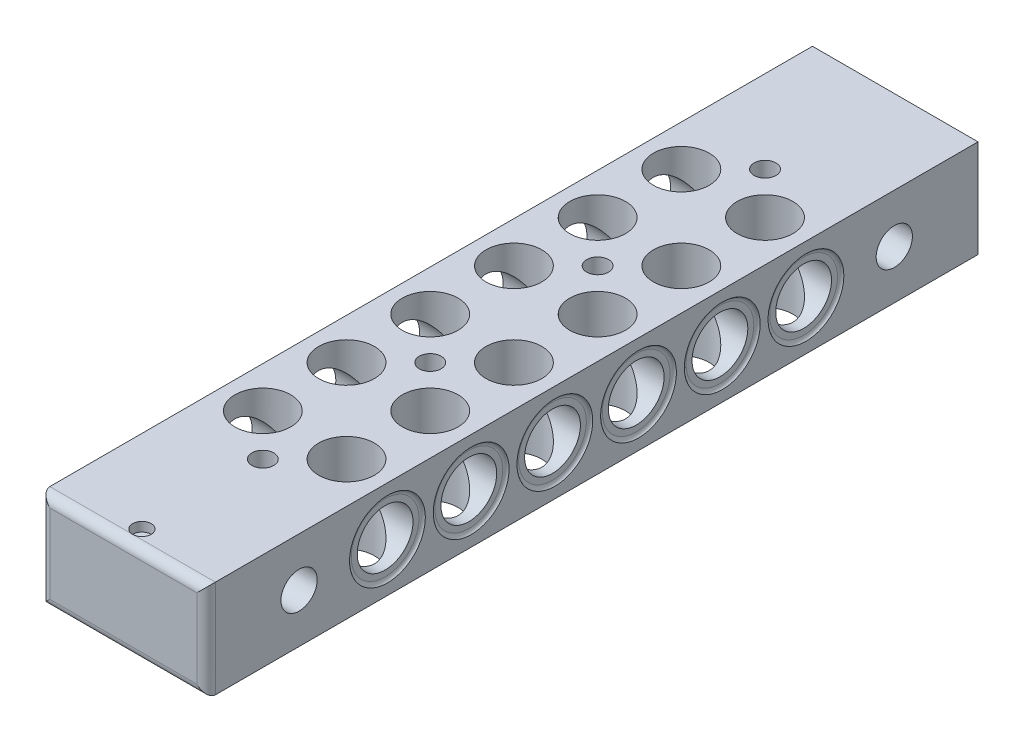
from build123d import *

# Parameters (mm, degrees)
SKETCH1_W            = 17.8
SKETCH1_H            = 83
SKETCH1_R            = 1.175
SKETCH1_R_2          = 3
BOSS_EXTRUDE1_DEPTH  = 10.5
SKETCH3_R            = 1
CUT_EXTRUDE1_DEPTH   = 1
FILLET1_R            = 1
CUT_EXTRUDE2_REACH   = 48.809
SKETCH4_R            = 1.95
CUT_EXTRUDE4_REACH   = 48.809
SKETCH4_3_R          = 3
SKETCH4_4_R          = 4.075
SKETCH4_4_R_2        = 3
CUT_EXTRUDE5_DEPTH   = 0.25
FILLET8_R            = 0.5
FILLET8_OF_MIRROR3_R = 0.5


# Some blends are built 0.0001 mm under size
with BuildPart() as part:
    # Sketch1 → Boss-Extrude1 (new body)
    with BuildSketch(Plane(origin=(0, 0, 0), x_dir=(1, 0, 0), z_dir=(0, 1, 0))):
        with Locations((0, -0.5)):
            Rectangle(SKETCH1_W, SKETCH1_H)
        with Locations(Location((0, 27, 0), (0, 0, 90))):
            Circle(SKETCH1_R, mode=Mode.SUBTRACT)
        with Locations(Location((0, 9, 0), (0, 0, 90))):
            Circle(SKETCH1_R, mode=Mode.SUBTRACT)
        with Locations(Location((0, -9, 0), (0, 0, 90))):
            Circle(SKETCH1_R, mode=Mode.SUBTRACT)
        with Locations(Location((0, -27, 0), (0, 0, 90))):
            Circle(SKETCH1_R, mode=Mode.SUBTRACT)
        with Locations(Location((-4.5, -22.5, 0), (0, 0, 90))):
            Circle(SKETCH1_R_2, mode=Mode.SUBTRACT)
        with Locations(Location((-4.5, -13.5, 0), (0, 0, 90))):
            Circle(SKETCH1_R_2, mode=Mode.SUBTRACT)
        with Locations(Location((-4.5, -4.5, 0), (0, 0, 90))):
            Circle(SKETCH1_R_2, mode=Mode.SUBTRACT)
        with Locations(Location((-4.5, 4.5, 0), (0, 0, 90))):
            Circle(SKETCH1_R_2, mode=Mode.SUBTRACT)
        with Locations(Location((-4.5, 13.5, 0), (0, 0, 90))):
            Circle(SKETCH1_R_2, mode=Mode.SUBTRACT)
        with Locations(Location((-4.5, 22.5, 0), (0, 0, 90))):
            Circle(SKETCH1_R_2, mode=Mode.SUBTRACT)
        with Locations(Location((4.5, -13.5, 0), (0, 0, 90))):
            Circle(SKETCH1_R_2, mode=Mode.SUBTRACT)
        with Locations(Location((4.5, -4.5, 0), (0, 0, 90))):
            Circle(SKETCH1_R_2, mode=Mode.SUBTRACT)
        with Locations(Location((4.5, 4.5, 0), (0, 0, 90))):
            Circle(SKETCH1_R_2, mode=Mode.SUBTRACT)
        with Locations(Location((4.5, 13.5, 0), (0, 0, 90))):
            Circle(SKETCH1_R_2, mode=Mode.SUBTRACT)
        with Locations(Location((4.5, 22.5, 0), (0, 0, 90))):
            Circle(SKETCH1_R_2, mode=Mode.SUBTRACT)
        with Locations(Location((4.5, -22.5, 0), (0, 0, 90))):
            Circle(SKETCH1_R_2, mode=Mode.SUBTRACT)
    extrude(amount=BOSS_EXTRUDE1_DEPTH)

    # Sketch3 → Cut-Extrude1 (cut)
    with BuildSketch(Plane(origin=(0, 10.5, 0), x_dir=(1, 0, 0), z_dir=(0, 1, 0))):
        with Locations(Location((0, -40, 0), (0, 0, 270))):
            Circle(SKETCH3_R)
    extrude(amount=-CUT_EXTRUDE1_DEPTH, mode=Mode.SUBTRACT)

    # Fillet1
    fillet1_edges = [part.edges().sort_by_distance(p)[0] for p in [
        (0, 10.5, 42),
        (0, 0, 42),
        (-8.9, 5.25, 42),
        (8.9, 5.25, 42),
    ]]
    fillet(fillet1_edges, radius=FILLET1_R - 0.0001)  # a hair under: the kernel refuses the full size

    # Sketch4 → Cut-Extrude2 (cut, up to next)
    with BuildSketch(Plane(origin=(8.9, 0, 0), x_dir=(0, 0, -1), z_dir=(1, 0, 0)), mode=Mode.PRIVATE) as cut_extrude2_sk1:
        with Locations((-32, 5.25)):
            Circle(SKETCH4_R)
    cut_extrude2_tool1 = extrude(cut_extrude2_sk1.sketch, amount=-CUT_EXTRUDE2_REACH, mode=Mode.PRIVATE) & part.part
    # Sketch4 → Cut-Extrude2 (cut, up to next)
    with BuildSketch(Plane(origin=(8.9, 0, 0), x_dir=(0, 0, -1), z_dir=(1, 0, 0)), mode=Mode.PRIVATE) as cut_extrude2_sk2:
        with Locations((32, 5.25)):
            Circle(SKETCH4_R)
    cut_extrude2_tool2 = extrude(cut_extrude2_sk2.sketch, amount=-CUT_EXTRUDE2_REACH, mode=Mode.PRIVATE) & part.part
    add(cut_extrude2_tool1.solids().sort_by_distance((8.9, 5.25, 32))[0], mode=Mode.SUBTRACT)
    add(cut_extrude2_tool2.solids().sort_by_distance((8.9, 5.25, -32))[0], mode=Mode.SUBTRACT)

    # Sketch4<3> → Cut-Extrude4 (cut, up to next)
    with BuildSketch(Plane(origin=(8.9, 0, 0), x_dir=(0, 0, -1), z_dir=(1, 0, 0)), mode=Mode.PRIVATE) as cut_extrude4_sk1:
        with Locations((-22.5, 5.25)):
            Circle(SKETCH4_3_R)
    cut_extrude4_tool1 = extrude(cut_extrude4_sk1.sketch, amount=-CUT_EXTRUDE4_REACH, mode=Mode.PRIVATE) & part.part
    # Sketch4<3> → Cut-Extrude4 (cut, up to next)
    with BuildSketch(Plane(origin=(8.9, 0, 0), x_dir=(0, 0, -1), z_dir=(1, 0, 0)), mode=Mode.PRIVATE) as cut_extrude4_sk2:
        with Locations((-13.5, 5.25)):
            Circle(SKETCH4_3_R)
    cut_extrude4_tool2 = extrude(cut_extrude4_sk2.sketch, amount=-CUT_EXTRUDE4_REACH, mode=Mode.PRIVATE) & part.part
    # Sketch4<3> → Cut-Extrude4 (cut, up to next)
    with BuildSketch(Plane(origin=(8.9, 0, 0), x_dir=(0, 0, -1), z_dir=(1, 0, 0)), mode=Mode.PRIVATE) as cut_extrude4_sk3:
        with Locations((-4.5, 5.25)):
            Circle(SKETCH4_3_R)
    cut_extrude4_tool3 = extrude(cut_extrude4_sk3.sketch, amount=-CUT_EXTRUDE4_REACH, mode=Mode.PRIVATE) & part.part
    # Sketch4<3> → Cut-Extrude4 (cut, up to next)
    with BuildSketch(Plane(origin=(8.9, 0, 0), x_dir=(0, 0, -1), z_dir=(1, 0, 0)), mode=Mode.PRIVATE) as cut_extrude4_sk4:
        with Locations((4.5, 5.25)):
            Circle(SKETCH4_3_R)
    cut_extrude4_tool4 = extrude(cut_extrude4_sk4.sketch, amount=-CUT_EXTRUDE4_REACH, mode=Mode.PRIVATE) & part.part
    # Sketch4<3> → Cut-Extrude4 (cut, up to next)
    with BuildSketch(Plane(origin=(8.9, 0, 0), x_dir=(0, 0, -1), z_dir=(1, 0, 0)), mode=Mode.PRIVATE) as cut_extrude4_sk5:
        with Locations((13.5, 5.25)):
            Circle(SKETCH4_3_R)
    cut_extrude4_tool5 = extrude(cut_extrude4_sk5.sketch, amount=-CUT_EXTRUDE4_REACH, mode=Mode.PRIVATE) & part.part
    # Sketch4<3> → Cut-Extrude4 (cut, up to next)
    with BuildSketch(Plane(origin=(8.9, 0, 0), x_dir=(0, 0, -1), z_dir=(1, 0, 0)), mode=Mode.PRIVATE) as cut_extrude4_sk6:
        with Locations((22.5, 5.25)):
            Circle(SKETCH4_3_R)
    cut_extrude4_tool6 = extrude(cut_extrude4_sk6.sketch, amount=-CUT_EXTRUDE4_REACH, mode=Mode.PRIVATE) & part.part
    cut_extrude4_1 = cut_extrude4_tool1.solids().sort_by_distance((8.9, 5.25, 22.5))[0]
    add(cut_extrude4_1, mode=Mode.SUBTRACT)
    cut_extrude4_2 = cut_extrude4_tool2.solids().sort_by_distance((8.9, 5.25, 13.5))[0]
    add(cut_extrude4_2, mode=Mode.SUBTRACT)
    cut_extrude4_3 = cut_extrude4_tool3.solids().sort_by_distance((8.9, 5.25, 4.5))[0]
    add(cut_extrude4_3, mode=Mode.SUBTRACT)
    cut_extrude4_4 = cut_extrude4_tool4.solids().sort_by_distance((8.9, 5.25, -4.5))[0]
    add(cut_extrude4_4, mode=Mode.SUBTRACT)
    cut_extrude4_5 = cut_extrude4_tool5.solids().sort_by_distance((8.9, 5.25, -13.5))[0]
    add(cut_extrude4_5, mode=Mode.SUBTRACT)
    cut_extrude4_6 = cut_extrude4_tool6.solids().sort_by_distance((8.9, 5.25, -22.5))[0]
    add(cut_extrude4_6, mode=Mode.SUBTRACT)
    cut_extrude4 = cut_extrude4_1 + cut_extrude4_2 + cut_extrude4_3 + cut_extrude4_4 + cut_extrude4_5 + cut_extrude4_6  # Cut-Extrude4 as one shape, for the pattern or mirror that repeats it

    # Sketch4<4> → Cut-Extrude5 (cut)
    # profile 1 of 6: a face of its own
    with BuildSketch(Plane(origin=(8.9, 0, 0), x_dir=(0, 0, -1), z_dir=(1, 0, 0))):
        with Locations((-13.5, 5.25)):
            Circle(SKETCH4_4_R)
        with Locations((-13.5, 5.25)):
            Circle(SKETCH4_4_R_2, mode=Mode.SUBTRACT)
    # profile 2 of 6: a face of its own
    with BuildSketch(Plane(origin=(8.9, 0, 0), x_dir=(0, 0, -1), z_dir=(1, 0, 0))):
        with Locations((-22.5, 5.25)):
            Circle(SKETCH4_4_R)
        with Locations((-22.5, 5.25)):
            Circle(SKETCH4_4_R_2, mode=Mode.SUBTRACT)
    # profile 3 of 6: a face of its own
    with BuildSketch(Plane(origin=(8.9, 0, 0), x_dir=(0, 0, -1), z_dir=(1, 0, 0))):
        with Locations((-4.5, 5.25)):
            Circle(SKETCH4_4_R)
        with Locations((-4.5, 5.25)):
            Circle(SKETCH4_4_R_2, mode=Mode.SUBTRACT)
    # profile 4 of 6: a face of its own
    with BuildSketch(Plane(origin=(8.9, 0, 0), x_dir=(0, 0, -1), z_dir=(1, 0, 0))):
        with Locations((4.5, 5.25)):
            Circle(SKETCH4_4_R)
        with Locations((4.5, 5.25)):
            Circle(SKETCH4_4_R_2, mode=Mode.SUBTRACT)
    # profile 5 of 6: a face of its own
    with BuildSketch(Plane(origin=(8.9, 0, 0), x_dir=(0, 0, -1), z_dir=(1, 0, 0))):
        with Locations((13.5, 5.25)):
            Circle(SKETCH4_4_R)
        with Locations((13.5, 5.25)):
            Circle(SKETCH4_4_R_2, mode=Mode.SUBTRACT)
    # profile 6 of 6: a face of its own
    with BuildSketch(Plane(origin=(8.9, 0, 0), x_dir=(0, 0, -1), z_dir=(1, 0, 0))):
        with Locations((22.5, 5.25)):
            Circle(SKETCH4_4_R)
        with Locations((22.5, 5.25)):
            Circle(SKETCH4_4_R_2, mode=Mode.SUBTRACT)
    cut_extrude5 = extrude(amount=-CUT_EXTRUDE5_DEPTH, mode=Mode.SUBTRACT)

    # Fillet8
    # the kernel refuses this fillet: 0.5 mm, written as the material it adds along each edge
    with BuildSketch(Plane(origin=(8.65, 5.25, -22.5), x_dir=(0, 0, -1), z_dir=(0, -1, 0))) as fillet8_piece_1:
        with BuildLine():
            CenterArc((3.641987298, 0.5), FILLET8_R, 270, 60)
            Line((3.641987298, 0), (3.641987298, -0.01))
            Line((3.641987298, -0.01), (4.075, -0.01))
            Line((4.075, -0.01), (4.085, 0))
            ThreePointArc((4.085, 0), (4.085, 0.125), (4.083660254, 0.245))
            Line((4.083660254, 0.245), (4.075, 0.25))
        make_face()
    revolve(axis=Axis((8.65, 5.25, -22.5), (1, 0, 0)))
    with BuildSketch(Plane(origin=(8.65, 5.25, -13.5), x_dir=(0, 0, -1), z_dir=(0, -1, 0))) as fillet8_piece_2:
        with BuildLine():
            CenterArc((3.641987298, 0.5), FILLET8_R, 270, 60)
            Line((3.641987298, 0), (3.641987298, -0.01))
            Line((3.641987298, -0.01), (4.075, -0.01))
            Line((4.075, -0.01), (4.085, 0))
            ThreePointArc((4.085, 0), (4.085, 0.125), (4.083660254, 0.245))
            Line((4.083660254, 0.245), (4.075, 0.25))
        make_face()
    revolve(axis=Axis((8.65, 5.25, -13.5), (1, 0, 0)))
    with BuildSketch(Plane(origin=(8.65, 5.25, -4.5), x_dir=(0, 0, -1), z_dir=(0, -1, 0))) as fillet8_piece_3:
        with BuildLine():
            CenterArc((3.641987298, 0.5), FILLET8_R, 270, 60)
            Line((3.641987298, 0), (3.641987298, -0.01))
            Line((3.641987298, -0.01), (4.075, -0.01))
            Line((4.075, -0.01), (4.085, 0))
            ThreePointArc((4.085, 0), (4.085, 0.125), (4.083660254, 0.245))
            Line((4.083660254, 0.245), (4.075, 0.25))
        make_face()
    revolve(axis=Axis((8.65, 5.25, -4.5), (1, 0, 0)))
    with BuildSketch(Plane(origin=(8.65, 5.25, 4.5), x_dir=(0, 0, -1), z_dir=(0, -1, 0))) as fillet8_piece_4:
        with BuildLine():
            CenterArc((3.641987298, 0.5), FILLET8_R, 270, 60)
            Line((3.641987298, 0), (3.641987298, -0.01))
            Line((3.641987298, -0.01), (4.075, -0.01))
            Line((4.075, -0.01), (4.085, 0))
            ThreePointArc((4.085, 0), (4.085, 0.125), (4.083660254, 0.245))
            Line((4.083660254, 0.245), (4.075, 0.25))
        make_face()
    revolve(axis=Axis((8.65, 5.25, 4.5), (1, 0, 0)))
    with BuildSketch(Plane(origin=(8.65, 5.25, 22.5), x_dir=(0, 0, -1), z_dir=(0, -1, 0))) as fillet8_piece_5:
        with BuildLine():
            CenterArc((3.641987298, 0.5), FILLET8_R, 270, 60)
            Line((3.641987298, 0), (3.641987298, -0.01))
            Line((3.641987298, -0.01), (4.075, -0.01))
            Line((4.075, -0.01), (4.085, 0))
            ThreePointArc((4.085, 0), (4.085, 0.125), (4.083660254, 0.245))
            Line((4.083660254, 0.245), (4.075, 0.25))
        make_face()
    revolve(axis=Axis((8.65, 5.25, 22.5), (1, 0, 0)))
    with BuildSketch(Plane(origin=(8.65, 5.25, 13.5), x_dir=(0, 0, -1), z_dir=(0, -1, 0))) as fillet8_piece_6:
        with BuildLine():
            CenterArc((3.641987298, 0.5), FILLET8_R, 270, 60)
            Line((3.641987298, 0), (3.641987298, -0.01))
            Line((3.641987298, -0.01), (4.075, -0.01))
            Line((4.075, -0.01), (4.085, 0))
            ThreePointArc((4.085, 0), (4.085, 0.125), (4.083660254, 0.245))
            Line((4.083660254, 0.245), (4.075, 0.25))
        make_face()
    revolve(axis=Axis((8.65, 5.25, 13.5), (1, 0, 0)))

    # Mirror3: Cut-Extrude4, Cut-Extrude5 across plane
    add(cut_extrude4.mirror(Plane(origin=(0, 0, 0), x_dir=(0, 0, 1), z_dir=(1, 0, 0))), mode=Mode.SUBTRACT)
    add(cut_extrude5.mirror(Plane(origin=(0, 0, 0), x_dir=(0, 0, 1), z_dir=(1, 0, 0))), mode=Mode.SUBTRACT)

    # Fillet8 of Mirror3
    # the kernel refuses this fillet: 0.5 mm, written as the material it adds along each edge
    with BuildSketch(Plane(origin=(-8.65, 5.25, -22.5), x_dir=(0, 0, -1), z_dir=(0, -1, 0))) as fillet8_of_mirror3_piece_1:
        with BuildLine():
            CenterArc((3.641987298, -0.5), FILLET8_OF_MIRROR3_R, 30, 60)
            Line((3.641987298, 0), (3.641987298, 0.01))
            Line((3.641987298, 0.01), (4.075, 0.01))
            Line((4.075, 0.01), (4.085, 0))
            ThreePointArc((4.085, 0), (4.085, -0.125), (4.083660254, -0.245))
            Line((4.083660254, -0.245), (4.075, -0.25))
        make_face()
    revolve(axis=Axis((-8.65, 5.25, -22.5), (1, 0, 0)))
    with BuildSketch(Plane(origin=(-8.65, 5.25, -13.5), x_dir=(0, 0, -1), z_dir=(0, -1, 0))) as fillet8_of_mirror3_piece_2:
        with BuildLine():
            CenterArc((3.641987298, -0.5), FILLET8_OF_MIRROR3_R, 30, 60)
            Line((3.641987298, 0), (3.641987298, 0.01))
            Line((3.641987298, 0.01), (4.075, 0.01))
            Line((4.075, 0.01), (4.085, 0))
            ThreePointArc((4.085, 0), (4.085, -0.125), (4.083660254, -0.245))
            Line((4.083660254, -0.245), (4.075, -0.25))
        make_face()
    revolve(axis=Axis((-8.65, 5.25, -13.5), (1, 0, 0)))
    with BuildSketch(Plane(origin=(-8.65, 5.25, -4.5), x_dir=(0, 0, -1), z_dir=(0, -1, 0))) as fillet8_of_mirror3_piece_3:
        with BuildLine():
            CenterArc((3.641987298, -0.5), FILLET8_OF_MIRROR3_R, 30, 60)
            Line((3.641987298, 0), (3.641987298, 0.01))
            Line((3.641987298, 0.01), (4.075, 0.01))
            Line((4.075, 0.01), (4.085, 0))
            ThreePointArc((4.085, 0), (4.085, -0.125), (4.083660254, -0.245))
            Line((4.083660254, -0.245), (4.075, -0.25))
        make_face()
    revolve(axis=Axis((-8.65, 5.25, -4.5), (1, 0, 0)))
    with BuildSketch(Plane(origin=(-8.65, 5.25, 4.5), x_dir=(0, 0, -1), z_dir=(0, -1, 0))) as fillet8_of_mirror3_piece_4:
        with BuildLine():
            CenterArc((3.641987298, -0.5), FILLET8_OF_MIRROR3_R, 30, 60)
            Line((3.641987298, 0), (3.641987298, 0.01))
            Line((3.641987298, 0.01), (4.075, 0.01))
            Line((4.075, 0.01), (4.085, 0))
            ThreePointArc((4.085, 0), (4.085, -0.125), (4.083660254, -0.245))
            Line((4.083660254, -0.245), (4.075, -0.25))
        make_face()
    revolve(axis=Axis((-8.65, 5.25, 4.5), (1, 0, 0)))
    with BuildSketch(Plane(origin=(-8.65, 5.25, 22.5), x_dir=(0, 0, -1), z_dir=(0, -1, 0))) as fillet8_of_mirror3_piece_5:
        with BuildLine():
            CenterArc((3.641987298, -0.5), FILLET8_OF_MIRROR3_R, 30, 60)
            Line((3.641987298, 0), (3.641987298, 0.01))
            Line((3.641987298, 0.01), (4.075, 0.01))
            Line((4.075, 0.01), (4.085, 0))
            ThreePointArc((4.085, 0), (4.085, -0.125), (4.083660254, -0.245))
            Line((4.083660254, -0.245), (4.075, -0.25))
        make_face()
    revolve(axis=Axis((-8.65, 5.25, 22.5), (1, 0, 0)))
    with BuildSketch(Plane(origin=(-8.65, 5.25, 13.5), x_dir=(0, 0, -1), z_dir=(0, -1, 0))) as fillet8_of_mirror3_piece_6:
        with BuildLine():
            CenterArc((3.641987298, -0.5), FILLET8_OF_MIRROR3_R, 30, 60)
            Line((3.641987298, 0), (3.641987298, 0.01))
            Line((3.641987298, 0.01), (4.075, 0.01))
            Line((4.075, 0.01), (4.085, 0))
            ThreePointArc((4.085, 0), (4.085, -0.125), (4.083660254, -0.245))
            Line((4.083660254, -0.245), (4.075, -0.25))
        make_face()
    revolve(axis=Axis((-8.65, 5.25, 13.5), (1, 0, 0)))


solid = part.part
